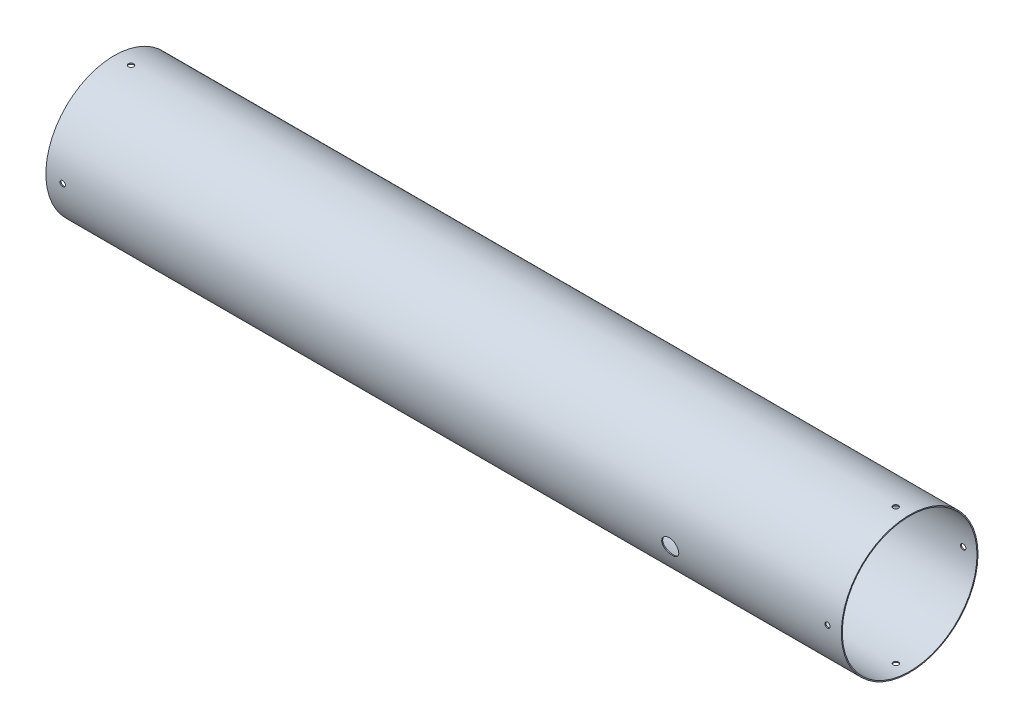
from build123d import *

# Parameters (mm, degrees)
SKETCH1_R               = 51.562
SKETCH1_R_2             = 50.8
BOSS_EXTRUDE1_DEPTH     = 300
CUT_EXTRUDE1_DEPTH      = 309.73496674
CUT_EXTRUDE1_DEPTH_BACK = 309.73496674
SKETCH3_R               = 6.35
SKETCH4_R               = 2
CUT_EXTRUDE2_DEPTH      = 309.734966871
CIRPATTERN1_COUNT       = 2
CIRPATTERN1_ANGLE       = 90


with BuildPart() as part:
    # Sketch1 → Boss-Extrude1 (new, symmetric)
    with BuildSketch(Plane(origin=(0, 0, 0), x_dir=(0, 0, -1), z_dir=(1, 0, 0))):
        Circle(SKETCH1_R)
        Circle(SKETCH1_R_2, mode=Mode.SUBTRACT)
    extrude(amount=BOSS_EXTRUDE1_DEPTH, both=True)

    # Sketch3 → Cut-Extrude1 (cut, two sides: drawn at the far end of the back side and taken through both)
    with BuildSketch(Plane.XY.offset(-CUT_EXTRUDE1_DEPTH_BACK)):
        with Locations((170.180000052, -8.89)):
            Circle(SKETCH3_R)
    extrude(amount=CUT_EXTRUDE1_DEPTH + CUT_EXTRUDE1_DEPTH_BACK, mode=Mode.SUBTRACT)

    # Sketch4 → Cut-Extrude2 (cut, symmetric)
    with BuildSketch(Plane.XY):
        with Locations((289.586, 0)):
            Circle(SKETCH4_R)
        with Locations((-287.3, 0)):
            Circle(SKETCH4_R)
    cut_extrude2 = extrude(amount=CUT_EXTRUDE2_DEPTH, both=True, mode=Mode.SUBTRACT)

    # CirPattern1: Cut-Extrude2 ×2 about axis
    cirpattern1_axis = Axis((300, 0, 0), (-1, 0, 0))
    for i in range(1, CIRPATTERN1_COUNT):
        add(cut_extrude2.rotate(cirpattern1_axis, i * CIRPATTERN1_ANGLE / (CIRPATTERN1_COUNT - 1)), mode=Mode.SUBTRACT)


solid = part.part
